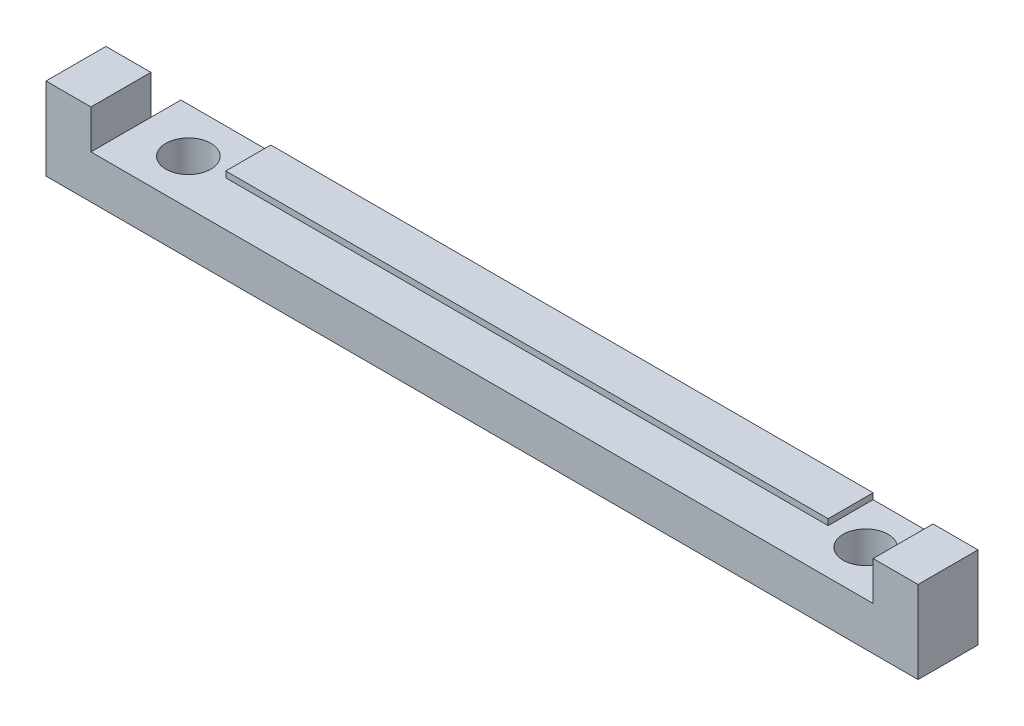
from build123d import *

# Parameters (mm, degrees)
BOSS_EXTRUDE1_DEPTH = 6
CUT_EXTRUDE2_REACH  = 60.766
SKETCH3_W           = 3
SKETCH3_H           = 2
CUT_EXTRUDE3_REACH  = 60.766
SKETCH4_R           = 1.5
SKETCH5_W           = 40.2
SKETCH5_H           = 3
BOSS_EXTRUDE2_DEPTH = 0.4


with BuildPart() as part:
    # Sketch1 → Boss-Extrude1 (new body)
    with BuildSketch(Plane.XY):
        Polygon((0, 5.5), (0, 0), (58.2, 0), (58.2, 5.5), (55.2, 5.5), (55.2, 2.9), (3, 2.9), (3, 5.5), align=None)
    extrude(amount=BOSS_EXTRUDE1_DEPTH)

    # Sketch3 → Cut-Extrude2 (cut, up to next)
    with BuildSketch(Plane(origin=(0, 5.5, 0), x_dir=(1, 0, 0), z_dir=(0, 1, 0)), mode=Mode.PRIVATE) as cut_extrude2_sk1:
        with Locations((1.5, -1)):
            Rectangle(SKETCH3_W, SKETCH3_H)
    cut_extrude2_tool1 = extrude(cut_extrude2_sk1.sketch, amount=-CUT_EXTRUDE2_REACH, mode=Mode.PRIVATE) & part.part
    # Sketch3 → Cut-Extrude2 (cut, up to next)
    with BuildSketch(Plane(origin=(0, 5.5, 0), x_dir=(1, 0, 0), z_dir=(0, 1, 0)), mode=Mode.PRIVATE) as cut_extrude2_sk2:
        with Locations((56.7, -1)):
            Rectangle(SKETCH3_W, SKETCH3_H)
    cut_extrude2_tool2 = extrude(cut_extrude2_sk2.sketch, amount=-CUT_EXTRUDE2_REACH, mode=Mode.PRIVATE) & part.part
    add(cut_extrude2_tool1.solids().sort_by_distance((1.5, 5.5, 1))[0], mode=Mode.SUBTRACT)
    add(cut_extrude2_tool2.solids().sort_by_distance((56.7, 5.5, 1))[0], mode=Mode.SUBTRACT)

    # Sketch4 → Cut-Extrude3 (cut, up to next)
    with BuildSketch(Plane(origin=(0, 5.5, 0), x_dir=(1, 0, 0), z_dir=(0, 1, 0)), mode=Mode.PRIVATE) as cut_extrude3_sk1:
        with Locations((6.5, -3)):
            Circle(SKETCH4_R)
    cut_extrude3_tool1 = extrude(cut_extrude3_sk1.sketch, amount=-CUT_EXTRUDE3_REACH, mode=Mode.PRIVATE) & part.part
    # Sketch4 → Cut-Extrude3 (cut, up to next)
    with BuildSketch(Plane(origin=(0, 5.5, 0), x_dir=(1, 0, 0), z_dir=(0, 1, 0)), mode=Mode.PRIVATE) as cut_extrude3_sk2:
        with Locations((51.7, -3)):
            Circle(SKETCH4_R)
    cut_extrude3_tool2 = extrude(cut_extrude3_sk2.sketch, amount=-CUT_EXTRUDE3_REACH, mode=Mode.PRIVATE) & part.part
    add(cut_extrude3_tool1.solids().sort_by_distance((6.5, 5.5, 3))[0], mode=Mode.SUBTRACT)
    add(cut_extrude3_tool2.solids().sort_by_distance((51.7, 5.5, 3))[0], mode=Mode.SUBTRACT)

    # Sketch5 → Boss-Extrude2 (add)
    with BuildSketch(Plane(origin=(0, 2.9, 0), x_dir=(1, 0, 0), z_dir=(0, 1, 0))):
        with Locations((29.1, -1.5)):
            Rectangle(SKETCH5_W, SKETCH5_H)
    extrude(amount=BOSS_EXTRUDE2_DEPTH)


solid = part.part
